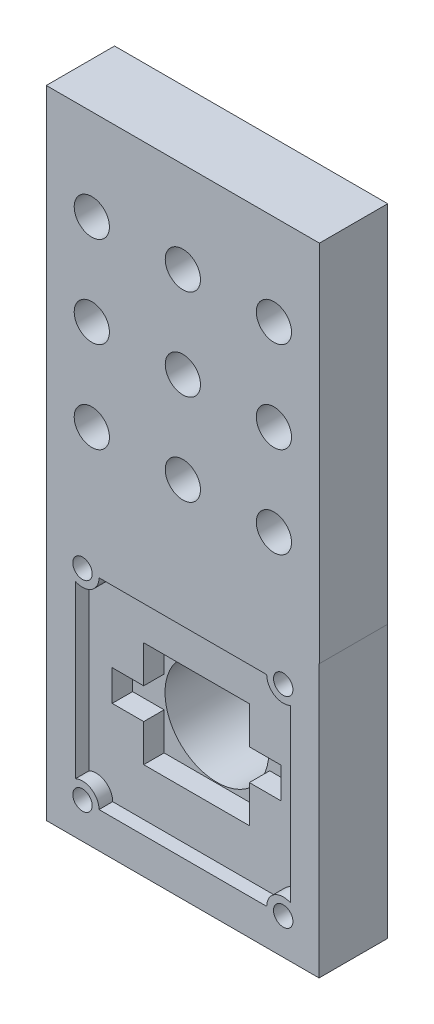
from build123d import *

# Parameters (mm, degrees)
SKETCH1_W                    = 38
SKETCH1_H                    = 38
BOSS_EXTRUDE1_DEPTH          = 9.525
F_36_0_1065_DIAMETER_HOLE2_D = 2.7051
SKETCH8_W                    = 38.1
SKETCH8_H                    = 9.525
BOSS_EXTRUDE2_DEPTH          = 50.8
F_10_0_1935_DIAMETER_HOLE1_D = 4.9149
CUT_EXTRUDE2_DEPTH           = 1.905
CUT_EXTRUDE4_START           = 1.905
SKETCH13_W                   = 14.732
SKETCH13_H                   = 14.732
CUT_EXTRUDE4_DEPTH           = 4.7498
SKETCH14_W                   = 23.5204
SKETCH14_H                   = 4.318
CUT_EXTRUDE5_DEPTH           = 2.8448
SKETCH15_R                   = 12.7
BOSS_EXTRUDE3_DEPTH          = 6.9596
SKETCH12_R                   = 7.239
CUT_EXTRUDE3_DEPTH           = 74.807230243
CHAMFER1_SIZE2               = 3.245314778
CHAMFER1_SIZE                = 6.9596
FILLET4_R                    = 2.54
LPATTERN1_COUNT              = 3
LPATTERN1_PITCH              = 12.7


with BuildPart() as part:
    # Sketch1 → Boss-Extrude1 (new body)
    with BuildSketch(Plane(origin=(0, 0, 0), x_dir=(0, 1, 0), z_dir=(0, 0, 1))):
        Rectangle(SKETCH1_W, SKETCH1_H)
    extrude(amount=BOSS_EXTRUDE1_DEPTH)

    # #36 (0.1065) Diameter Hole2 (through all)
    with Locations(Plane.XY.offset(9.525)):
        with Locations((-14, -14), (14, -14), (14, 14), (-14, 14)):
            Hole(F_36_0_1065_DIAMETER_HOLE2_D / 2)

    # Sketch8 → Boss-Extrude2 (add)
    with BuildSketch(Plane(origin=(0, 19, 0), x_dir=(-1, 0, 0), z_dir=(0, 1, 0))):
        with Locations((0, 4.7625)):
            Rectangle(SKETCH8_W, SKETCH8_H)
    extrude(amount=BOSS_EXTRUDE2_DEPTH)

    # #10 (0.1935) Diameter Hole1 (through all)
    with Locations(Plane(origin=(0, 0, 0), x_dir=(1, 0, 0), z_dir=(0, 0, -1))):
        with Locations((-12.7, -57.1), (0, -57.1), (12.7, -57.1), (25.4, -57.1), (38.1, -57.1)):
            f_10_0_1935_diameter_hole1 = Hole(F_10_0_1935_DIAMETER_HOLE1_D / 2)

    # Sketch11 → Cut-Extrude2 (cut)
    with BuildSketch(Plane.XY.offset(9.525)):
        with BuildLine():
            Line((11.69495, -14), (-11.69495, -14))
            ThreePointArc((-11.69495, -14), (-12.76702064, -12.052432953), (-14.986, -11.916479061))
            Line((-14.986, -11.916479061), (-14.986, 11.916479061))
            ThreePointArc((-14.986, 11.916479061), (-12.76702064, 12.052432953), (-11.69495, 14))
            Line((-11.69495, 14), (11.69495, 14))
            ThreePointArc((11.69495, 14), (12.76702064, 12.052432953), (14.986, 11.916479061))
            Line((14.986, 11.916479061), (14.986, -11.916479061))
            ThreePointArc((14.986, -11.916479061), (12.76702064, -12.052432953), (11.69495, -14))
        make_face()
    extrude(amount=-CUT_EXTRUDE2_DEPTH, mode=Mode.SUBTRACT)

    # Sketch13 → Cut-Extrude4 (cut)
    with BuildSketch(Plane.XY.offset(7.62).offset(CUT_EXTRUDE4_START)):
        Rectangle(SKETCH13_W, SKETCH13_H)
    extrude(amount=-CUT_EXTRUDE4_DEPTH, mode=Mode.SUBTRACT)

    # Sketch14 → Cut-Extrude5 (cut)
    with BuildSketch(Plane.XY.offset(7.62)):
        Rectangle(SKETCH14_W, SKETCH14_H)
    extrude(amount=-CUT_EXTRUDE5_DEPTH, mode=Mode.SUBTRACT)

    # Sketch15 → Boss-Extrude3 (add)
    with BuildSketch(Plane(origin=(0, 0, 0), x_dir=(1, 0, 0), z_dir=(0, 0, -1))):
        with Locations(Location((0, 0, 0), (0, 0, 180))):
            Circle(SKETCH15_R)
    extrude(amount=BOSS_EXTRUDE3_DEPTH)

    # Sketch12 → Cut-Extrude3 (cut, through all)
    with BuildSketch(Plane.XY.offset(7.62)):
        Circle(SKETCH12_R)
    extrude(amount=-CUT_EXTRUDE3_DEPTH, mode=Mode.SUBTRACT)

    # Chamfer1
    chamfer1_edges = [part.edges().sort_by_distance(p)[0] for p in [
        (12.7, 0, -6.9596),
    ]]
    chamfer1_side = [part.faces().sort_by_distance(p)[0] for p in [
        (12.7, 0, -6.894693704),
    ]]
    chamfer(chamfer1_edges, length=CHAMFER1_SIZE - 0.0001, length2=CHAMFER1_SIZE2 - 0.0001, reference=chamfer1_side[0])  # a hair under: the kernel refuses the full size

    # Fillet3: read off the stored shape, not the designer's step
    # Fillet3 outline → Fillet3 (revolve)
    with BuildSketch(Plane.XZ):
        with BuildLine():
            Line((11.161307538, 0), (11.161307538, -3.299736634))
            ThreePointArc((11.161307538, -3.299736634), (13.270189279, -0.895017887), (16.340856541, 0))
            Line((16.340856541, 0), (11.161307538, 0))
        make_face()
    revolve(axis=Axis((0, 0, 0), (0, 0, 1)))

    # Fillet4
    fillet4_edges = [part.edges().sort_by_distance(p)[0] for p in [
        (9.454785222, 0, -6.9596),
    ]]
    fillet(fillet4_edges, radius=FILLET4_R)

    # LPattern1: #10 (0.1935) Diameter Hole1 ×3
    with Locations(*[(0, -i * LPATTERN1_PITCH, 0) for i in range(1, LPATTERN1_COUNT)]):
        add(f_10_0_1935_diameter_hole1, mode=Mode.SUBTRACT)


solid = part.part
